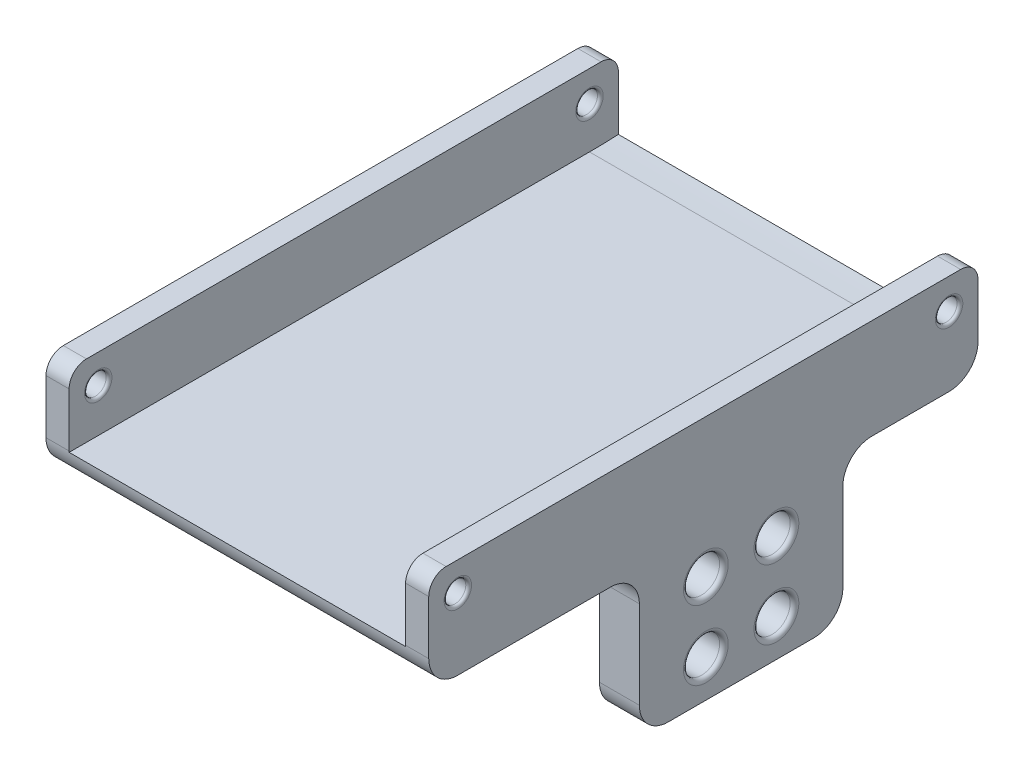
from build123d import *

# Parameters (mm, degrees)
SKETCH1_W           = 66.2
SKETCH1_H           = 95
BOSS_EXTRUDE1_DEPTH = 15
SKETCH2_W           = 4
SKETCH2_H           = 95
BOSS_EXTRUDE2_DEPTH = 12.5
SKETCH3_R           = 1.875
CUT_EXTRUDE1_DEPTH  = 86.993836988
SKETCH4_W           = 25.2
SKETCH4_H           = 25.2
SKETCH4_W_2         = 23.369505118
SKETCH4_W_3         = 36.430494882
CUT_EXTRUDE2_DEPTH  = 86.993836988
SKETCH6_W           = 6.9
SKETCH6_H           = 25.2
BOSS_EXTRUDE3_DEPTH = 25.2
SKETCH8_R           = 3.125
CUT_EXTRUDE3_DEPTH  = 86.993836988
SKETCH9_W           = 52.4
SKETCH9_H           = 20.2
CUT_EXTRUDE4_DEPTH  = 73.67906803
BOSS_EXTRUDE4_DEPTH = 64
FILLET1_START       = -34
FILLET1_DEPTH       = 68
FILLET1_START_2     = -33.1
FILLET1_2_DEPTH     = 66.2
FILLET2_R           = 0.75
FILLET3_R           = 3
FILLET4_R           = 0.5


with BuildPart() as part:
    # Sketch1 → Boss-Extrude1 (new, symmetric)
    with BuildSketch(Plane(origin=(0, 0, 0), x_dir=(1, 0, 0), z_dir=(0, 1, 0))):
        Rectangle(SKETCH1_W, SKETCH1_H)
    extrude(amount=BOSS_EXTRUDE1_DEPTH, both=True)

    # Sketch2 → Boss-Extrude2 (add)
    with BuildSketch(Plane(origin=(0, 15, 0), x_dir=(1, 0, 0), z_dir=(0, 1, 0))):
        with Locations((-31.1, 0)):
            Rectangle(SKETCH2_W, SKETCH2_H)
        with Locations((31.1, 0)):
            Rectangle(SKETCH2_W, SKETCH2_H)
    extrude(amount=BOSS_EXTRUDE2_DEPTH)

    # Sketch3 → Cut-Extrude1 (cut, through all)
    with BuildSketch(Plane.ZY.offset(33.1)):
        with Locations((-42.5, 22.22)):
            Circle(SKETCH3_R)
        with Locations((42.469505118, 22.51)):
            Circle(SKETCH3_R)
    extrude(amount=-CUT_EXTRUDE1_DEPTH, mode=Mode.SUBTRACT)

    # Sketch4 → Cut-Extrude2 (cut, through all)
    with BuildSketch(Plane.ZY.offset(33.1)):
        with Locations((-6.530494882, -2.4)):
            Rectangle(SKETCH4_W, SKETCH4_H)
        with Locations((-35.815247441, -2.4)):
            Rectangle(SKETCH4_W_2, SKETCH4_H)
        with Locations((29.284752559, -2.4)):
            Rectangle(SKETCH4_W_3, SKETCH4_H)
    extrude(amount=-CUT_EXTRUDE2_DEPTH, mode=Mode.SUBTRACT)

    # Sketch6 → Boss-Extrude3 (add, through all)
    with BuildSketch(Plane.XZ.offset(-10.2)):
        with Locations((-29.65, -6.530494882)):
            Rectangle(SKETCH6_W, SKETCH6_H)
        with Locations((29.65, -6.530494882)):
            Rectangle(SKETCH6_W, SKETCH6_H)
    extrude(amount=BOSS_EXTRUDE3_DEPTH)

    # Sketch8 → Cut-Extrude3 (cut, through all)
    with BuildSketch(Plane.ZY.offset(33.1)):
        with Locations((-12.630494882, 3.5)):
            Circle(SKETCH8_R)
        with Locations((-12.630494882, -8.5)):
            Circle(SKETCH8_R)
        with Locations(Location((-0.430494882, -8.5, 0), (0, 0, 180))):
            Circle(SKETCH8_R)
        with Locations(Location((-0.430494882, 3.5, 0), (0, 0, 180))):
            Circle(SKETCH8_R)
    extrude(amount=-CUT_EXTRUDE3_DEPTH, mode=Mode.SUBTRACT)

    # Sketch9 → Cut-Extrude4 (cut, through all)
    with BuildSketch(Plane.XY.offset(11.069505118)):
        with Locations((0, -4.9)):
            Rectangle(SKETCH9_W, SKETCH9_H)
    extrude(amount=-CUT_EXTRUDE4_DEPTH, mode=Mode.SUBTRACT)

    # Sketch10 → Boss-Extrude4 (add)
    with BuildSketch(Plane(origin=(33.1, 0, 0), x_dir=(0, 0, -1), z_dir=(1, 0, 0))):
        with BuildLine():
            Line((42.5, 15), (47.5, 15))
            Line((47.5, 15), (47.5, 15.125078223))
            ThreePointArc((47.5, 15.125078223), (45.000782106, 15.031274446), (42.5, 15))
        make_face()
    extrude(amount=-BOSS_EXTRUDE4_DEPTH)

    # Fillet1: read off the stored shape, not the designer's step
    # Fillet1 outline → Fillet1 (cut)
    with BuildSketch(Plane.YZ.offset(FILLET1_START)):
        with BuildLine():
            Line((-15, 11.069505118), (-15, 6.069505118))
            ThreePointArc((-15, 6.069505118), (-13.535533906, 9.605039024), (-10, 11.069505118))
            Line((-10, 11.069505118), (-15, 11.069505118))
        make_face()
        with BuildLine():
            Line((10.2, 47.5), (10.2, 42.5))
            ThreePointArc((10.2, 42.5), (11.664466094, 46.035533906), (15.2, 47.5))
            Line((15.2, 47.5), (10.2, 47.5))
        make_face()
        with BuildLine():
            ThreePointArc((15.2, -47.5), (11.664466094, -46.035533906), (10.2, -42.5))
            Line((10.2, -42.5), (10.2, -47.5))
            Line((10.2, -47.5), (15.2, -47.5))
        make_face()
        with BuildLine():
            ThreePointArc((-10, -24.130494882), (-13.535533906, -22.666028788), (-15, -19.130494882))
            Line((-15, -19.130494882), (-15, -24.130494882))
            Line((-15, -24.130494882), (-10, -24.130494882))
        make_face()
    extrude(amount=FILLET1_DEPTH, mode=Mode.SUBTRACT)

    # Fillet1 2 outline → Fillet1 2 (add)
    with BuildSketch(Plane.YZ.offset(FILLET1_START_2)):
        with BuildLine():
            ThreePointArc((10.2, 16.069505118), (8.735533906, 12.533971212), (5.2, 11.069505118))
            Line((5.2, 11.069505118), (10.2, 11.069505118))
            Line((10.2, 11.069505118), (10.2, 16.069505118))
        make_face()
        with BuildLine():
            Line((10.2, -24.130494882), (5.2, -24.130494882))
            ThreePointArc((5.2, -24.130494882), (8.735533906, -25.594960976), (10.2, -29.130494882))
            Line((10.2, -29.130494882), (10.2, -24.130494882))
        make_face()
        with BuildLine():
            ThreePointArc((5.2, 6.069505118), (8.735533906, 4.605039024), (10.2, 1.069505118))
            Line((10.2, 1.069505118), (10.2, 6.069505118))
            Line((10.2, 6.069505118), (5.2, 6.069505118))
        make_face()
        with BuildLine():
            ThreePointArc((10.2, -14.130494882), (8.735533906, -17.666028788), (5.2, -19.130494882))
            Line((5.2, -19.130494882), (10.2, -19.130494882))
            Line((10.2, -19.130494882), (10.2, -14.130494882))
        make_face()
    extrude(amount=FILLET1_2_DEPTH)

    # Fillet2
    fillet2_edges = [part.edges().sort_by_distance(p)[0] for p in [
        (-26.2, 3.5, 2.694505118),
        (33.1, 3.5, 2.694505118),
        (26.2, 3.5, 2.694505118),
        (-33.1, 3.5, 2.694505118),
        (-26.2, -8.5, 2.694505118),
        (33.1, -8.5, 2.694505118),
        (26.2, -8.5, 2.694505118),
        (-33.1, -8.5, 2.694505118),
        (-26.2, -8.5, -15.755494882),
        (33.1, -8.5, -15.755494882),
        (26.2, -8.5, -15.755494882),
        (-33.1, -8.5, -15.755494882),
        (-26.2, 3.5, -15.755494882),
        (33.1, 3.5, -15.755494882),
        (26.2, 3.5, -15.755494882),
        (-33.1, 3.5, -15.755494882),
    ]]
    fillet(fillet2_edges, radius=FILLET2_R)

    # Fillet3
    fillet3_edges = [part.edges().sort_by_distance(p)[0] for p in [
        (-31.1, 27.5, 47.5),
        (-31.1, 27.5, -47.5),
        (31.1, 27.5, -47.5),
        (31.1, 27.5, 47.5),
    ]]
    fillet(fillet3_edges, radius=FILLET3_R)

    # Fillet4
    fillet4_edges = [part.edges().sort_by_distance(p)[0] for p in [
        (-29.1, 22.22, -44.375),
        (33.1, 22.22, -44.375),
        (29.1, 22.22, -44.375),
        (-33.1, 22.22, -44.375),
        (-29.1, 22.51, 40.594505118),
        (33.1, 22.51, 40.594505118),
        (29.1, 22.51, 40.594505118),
        (-33.1, 22.51, 40.594505118),
    ]]
    fillet(fillet4_edges, radius=FILLET4_R)


solid = part.part
